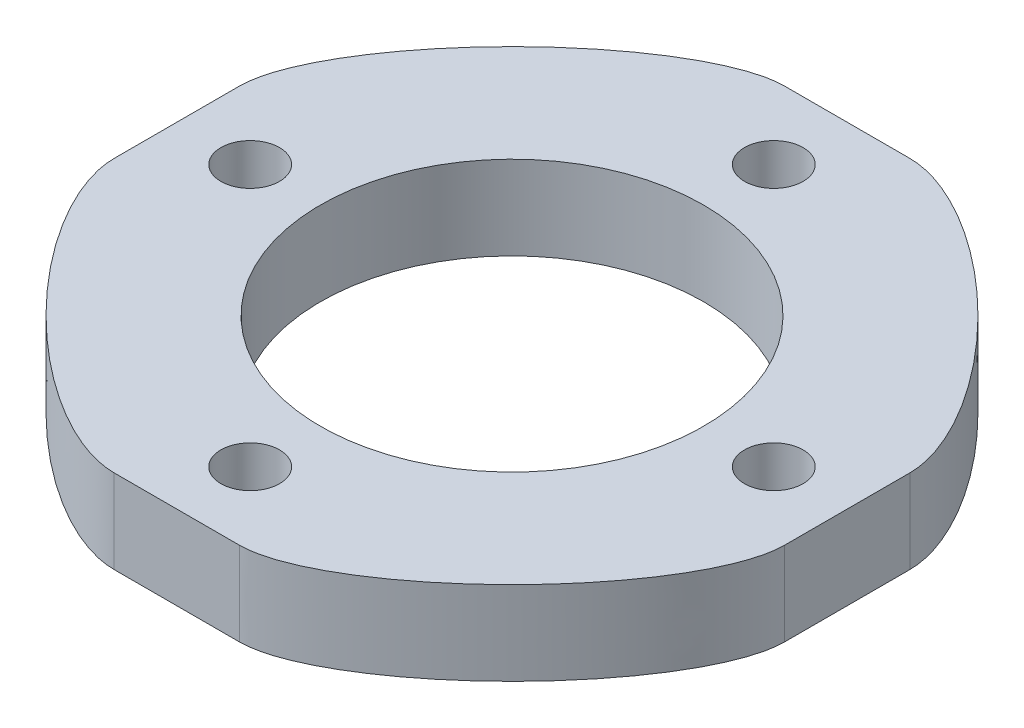
from build123d import *

# Parameters (mm, degrees)
SKETCH1_W           = 32
SKETCH1_H           = 32
BOSS_EXTRUDE1_DEPTH = 4
SKETCH2_R           = 9.15
SKETCH2_R_2         = 1.4
CUT_EXTRUDE1_DEPTH  = 4
FILLET1_SIZE        = 13


with BuildPart() as part:
    # Sketch1 → Boss-Extrude1 (new body)
    with BuildSketch(Plane(origin=(0, 0, 0), x_dir=(1, 0, 0), z_dir=(0, 1, 0))):
        with Locations((16, -16)):
            Rectangle(SKETCH1_W, SKETCH1_H)
    extrude(amount=BOSS_EXTRUDE1_DEPTH)

    # Sketch2 → Cut-Extrude1 (cut)
    with BuildSketch(Plane(origin=(0, 0, 0), x_dir=(-1, 0, 0), z_dir=(0, -1, 0))):
        with Locations(Location((-16, -16, 0), (0, 0, 90))):
            Circle(SKETCH2_R)
        with Locations(Location((-16, -28.5, 0), (0, 0, 90))):
            Circle(SKETCH2_R_2)
        with Locations(Location((-28.5, -16, 0), (0, 0, 90))):
            Circle(SKETCH2_R_2)
        with Locations(Location((-16, -3.5, 0), (0, 0, 90))):
            Circle(SKETCH2_R_2)
        with Locations(Location((-3.5, -16, 0), (0, 0, 90))):
            Circle(SKETCH2_R_2)
    extrude(amount=-CUT_EXTRUDE1_DEPTH, mode=Mode.SUBTRACT)

    # Fillet1
    # a fillet whose section is not a circle: 13 mm, written as the material it takes off along each edge
    with BuildSketch(Plane(origin=(0, -32.5, 0), x_dir=(1, 0, 0), z_dir=(0, 1, 0)), Plane(origin=(0, -32.5, 32), x_dir=(0, 0, -1), z_dir=(0, 1, 0))) as fillet1_piece_1:
        with BuildLine():
            Bezier((FILLET1_SIZE, 0), (0, 0), (0, -FILLET1_SIZE), weights=[1, 0.333333333, 1])
            Line((0, -FILLET1_SIZE), (0, 0))
            Line((0, 0), (FILLET1_SIZE, 0))
        make_face()
    extrude(amount=69, mode=Mode.SUBTRACT)
    with BuildSketch(Plane(origin=(32, -32.5, 0), x_dir=(-1, 0, 0), z_dir=(0, 1, 0)), Plane(origin=(32, -32.5, 32), x_dir=(0, 0, -1), z_dir=(0, 1, 0))) as fillet1_piece_2:
        with BuildLine():
            Bezier((FILLET1_SIZE, 0), (0, 0), (0, FILLET1_SIZE), weights=[1, 0.333333333, 1])
            Line((0, FILLET1_SIZE), (0, 0))
            Line((0, 0), (FILLET1_SIZE, 0))
        make_face()
    extrude(amount=69, mode=Mode.SUBTRACT)


solid = part.part
